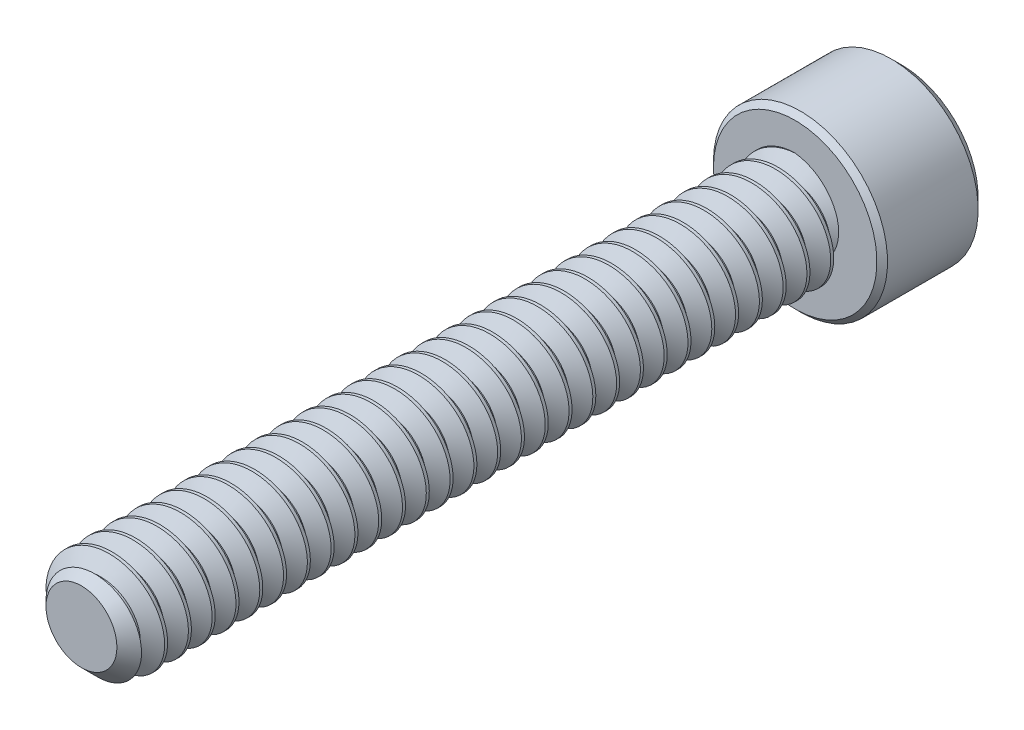
from build123d import *

# Parameters (mm, degrees)
SKETCH1_R          = 1.4224
EXTRUDE1_DEPTH     = 19.05
CHAMFER3_SIZE      = 0.47625
CUT_SWEEP1_PITCH   = 0.635
SKETCH6_R          = 2.3241
EXTRUDE2_DEPTH     = 2.8448
CUT_EXTRUDE1_DEPTH = 1.7859375
SKETCH8_R          = 1.374815329
CUT_EXTRUDE2_DEPTH = 0.28448
CUT_EXTRUDE2_DRAFT = -45
CHAMFER1_SIZE      = 0.28448
CHAMFER2_SIZE      = 0.14224


with BuildPart() as part:
    # Sketch1 → Extrude1 (new body)
    with BuildSketch(Plane.XY):
        Circle(SKETCH1_R)
    extrude(amount=-EXTRUDE1_DEPTH)

    # Chamfer3
    chamfer3_edges = [part.edges().sort_by_distance(p)[0] for p in [
        (-1.4224, 0, 0),
    ]]
    chamfer(chamfer3_edges, length=CHAMFER3_SIZE)

    # Cut-Sweep1: arcs per turn and ends read off the stored shape
    # Cut-Sweep1: the profile of Sketch3 profile screwed along a right-hand helix through 32 turns, 6 arcs to a turn; built about Z, then put on its axis
    cut_sweep1_z = Axis((0, 0, 0), (0, 0, 1))
    cut_sweep1_corners = [(1.4227, 0, -0.555798205), (1.009955401, 0, -0.3175), (1.009955401, 0, -0.238125), (1.4227, 0, 0.000173205)]
    with BuildLine(mode=Mode.PRIVATE) as cut_sweep1_profile:
        Line(cut_sweep1_corners[0], cut_sweep1_corners[1])
        Line(cut_sweep1_corners[1], cut_sweep1_corners[2])
        Line(cut_sweep1_corners[2], cut_sweep1_corners[3])
        Line(cut_sweep1_corners[3], cut_sweep1_corners[0])
    cut_sweep1_cap = Face(cut_sweep1_profile.wire())
    cut_sweep1_turn_angles = [0, 30, 60, 90, 120, 150, 180, 210, 240, 270, 300, 330, 360]
    cut_sweep1_turn_weights = [1, 0.8660254037844387, 1, 0.8660254037844387, 1, 0.8660254037844387, 1, 0.8660254037844387, 1, 0.8660254037844387, 1, 0.8660254037844387, 1]
    cut_sweep1_turn_rails = [Edge.make_bspline([Vector(p[0], p[1], 0).rotate(cut_sweep1_z, cut_sweep1_turn_angles[k]) / cut_sweep1_turn_weights[k] + Vector(0, 0, p[2] + CUT_SWEEP1_PITCH * cut_sweep1_turn_angles[k] / 360) for k in range(13)], [0, 0, 0, 1, 1, 2, 2, 3, 3, 4, 4, 5, 5, 6, 6, 6], 2, cut_sweep1_turn_weights) for p in cut_sweep1_corners]
    cut_sweep1_turn_sides = [Face.make_surface_from_curves(cut_sweep1_turn_rails[p[0]], cut_sweep1_turn_rails[p[1]]) for p in [(0, 1), (1, 2), (2, 3), (3, 0)]]
    cut_sweep1 = Plane(origin=(0, 0, 0), x_dir=(0, 1, 0), z_dir=(0, 0, -1)) * Solid(Shell([*[p.moved(Location((0, 0, CUT_SWEEP1_PITCH * i))) for i in range(32) for p in cut_sweep1_turn_sides], cut_sweep1_cap, cut_sweep1_cap.rotate(cut_sweep1_z, 11520).moved(Location((0, 0, CUT_SWEEP1_PITCH * 11520 / 360)))]))
    add(cut_sweep1, mode=Mode.SUBTRACT)

    # Sketch6 → Extrude2 (add)
    with BuildSketch(Plane(origin=(0, 0, -19.05), x_dir=(-1, 0, 0), z_dir=(0, 0, -1))):
        Circle(SKETCH6_R)
    extrude(amount=EXTRUDE2_DEPTH)

    # Sketch7 → Cut-Extrude1 (cut)
    with BuildSketch(Plane(origin=(0, 0, -21.8948), x_dir=(-1, 0, 0), z_dir=(0, 0, -1))):
        Polygon((0, 1.374815329), (-1.190625, 0.687407664), (-1.190625, -0.687407664), (0, -1.374815329), (1.190625, -0.687407664), (1.190625, 0.687407664), align=None)
    extrude(amount=-CUT_EXTRUDE1_DEPTH, mode=Mode.SUBTRACT)


with BuildPart() as cut_extrude2_tool:
    # Sketch8 → Cut-Extrude2 (with draft: the straight prism first)
    with BuildSketch(Plane(origin=(0, 0, -21.8948), x_dir=(-1, 0, 0), z_dir=(0, 0, -1))):
        Circle(SKETCH8_R)
    extrude(amount=-CUT_EXTRUDE2_DEPTH)
    # Cut-Extrude2: the draft: its side faces are tilted about the plane it starts from
    cut_extrude2_sides = [cut_extrude2_tool.faces().sort_by_distance(p)[0] for p in [
        (1.374815329, 0, -21.75256),
    ]]
    draft(cut_extrude2_sides, Plane(origin=(0, 0, -21.8948), x_dir=(-1, 0, 0), z_dir=(0, 0, -1)), CUT_EXTRUDE2_DRAFT)


with BuildPart() as part_1:
    add(part.part)

    # Cut-Extrude2: cut by cut_extrude2_tool
    add(cut_extrude2_tool.part, mode=Mode.SUBTRACT)

    # Chamfer1
    chamfer1_edges = [part_1.edges().sort_by_distance(p)[0] for p in [
        (2.3241, 0, -21.8948),
    ]]
    chamfer(chamfer1_edges, length=CHAMFER1_SIZE)

    # Chamfer2
    chamfer2_edges = [part_1.edges().sort_by_distance(p)[0] for p in [
        (2.3241, 0, -19.05),
    ]]
    chamfer(chamfer2_edges, length=CHAMFER2_SIZE)


solid = part_1.part
